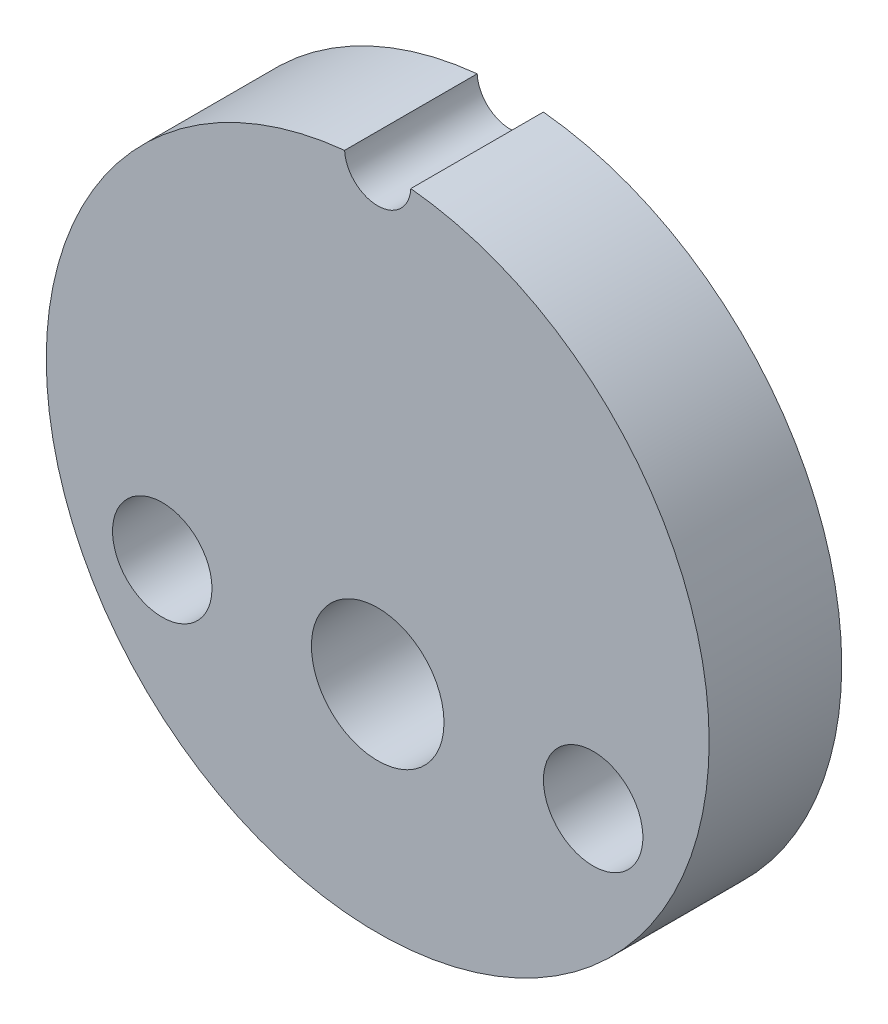
from build123d import *

# Parameters (mm, degrees)
SKETCH_1_R          = 10
SKETCH_1_R_2        = 1.5
SKETCH_1_R_3        = 2
EXTRUDE_1_DEPTH     = 4
SKETCH_2_R          = 1
CUT_EXTRUDE_1_DEPTH = 10


with BuildPart() as part:
    # 草图1 → 凸台-拉伸1 (new body)
    with BuildSketch(Plane.XY):
        with Locations((-0.589945763, 5.342825614)):
            Circle(SKETCH_1_R)
        with Locations((-7.089945763, 1.842825614)):
            Circle(SKETCH_1_R_2, mode=Mode.SUBTRACT)
        with Locations((5.910054237, 1.842825614)):
            Circle(SKETCH_1_R_2, mode=Mode.SUBTRACT)
        with Locations((-0.589945763, 1.842825614)):
            Circle(SKETCH_1_R_3, mode=Mode.SUBTRACT)
    extrude(amount=EXTRUDE_1_DEPTH)

    # 草图2 → 切除-拉伸1 (cut)
    with BuildSketch(Plane.XY.offset(4)):
        with Locations((-0.589945763, 15.342825614)):
            Circle(SKETCH_2_R)
    extrude(amount=-CUT_EXTRUDE_1_DEPTH, mode=Mode.SUBTRACT)


solid = part.part
